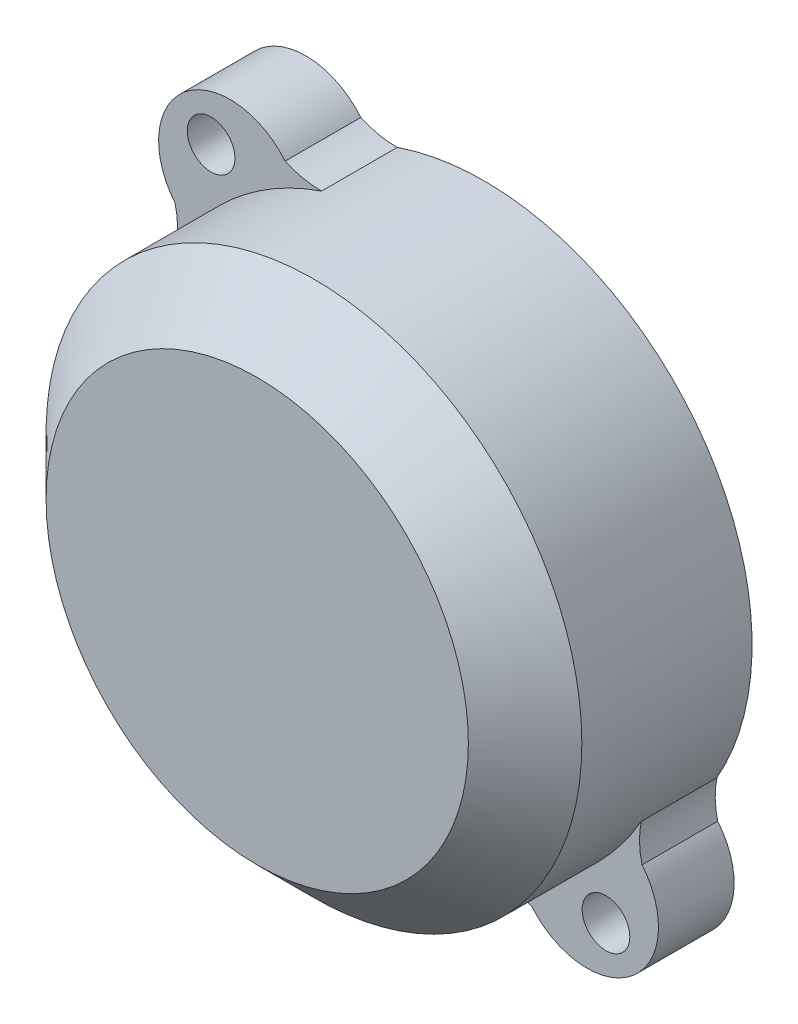
from build123d import *

# Parameters (mm, degrees)
SKETCH1_R           = 22.482
SKETCH1_R_2         = 19.45
SKETCH1_R_3         = 5
SKETCH1_R_4         = 2.8
BOSS_EXTRUDE1_DEPTH = 19.05
SKETCH1_5_R         = 2
BOSS_EXTRUDE3_DEPTH = 6.35
CHAMFER1_SIZE       = 4.7625
SHELL1_START        = -959.849406281
SHELL1_OUTLINE_R    = 20.481999936
SHELL1_DEPTH        = 13.459072749
SHELL1_2_DEPTH      = 4.349999936


with BuildPart() as part:
    # Sketch1 → Boss-Extrude1 (new body)
    # profile 1 of 6: a face of its own
    with BuildSketch(Plane.XY.offset(-959.849406281)):
        with Locations(Location((-167.581326331, 1325.789589838, 0), (0, 0, 180))):
            Circle(SKETCH1_R)
        with Locations((-167.581326331, 1325.789589838)):
            Circle(SKETCH1_R_2, mode=Mode.SUBTRACT)
    # profile 2 of 6: a face of its own
    with BuildSketch(Plane.XY.offset(-959.849406281)):
        with Locations((-167.581326331, 1325.789589838)):
            Circle(SKETCH1_R_2)
        with Locations((-158.719406684, 1324.967166478)):
            Circle(SKETCH1_R_3, mode=Mode.SUBTRACT)
        with Locations((-176.443245977, 1326.612013197)):
            Circle(SKETCH1_R_3, mode=Mode.SUBTRACT)
        with Locations((-168.704072827, 1313.691575939)):
            Circle(SKETCH1_R_4, mode=Mode.SUBTRACT)
        Polygon((-169.416951474, 1318.076211503), (-167.966159705, 1333.709036048), (-165.745701187, 1333.502968172), (-167.196492956, 1317.870143628), align=None, mode=Mode.SUBTRACT)
    # profile 3 of 6: a face of its own
    with BuildSketch(Plane.XY.offset(-959.849406281)):
        with Locations((-168.704072827, 1313.691575939)):
            Circle(SKETCH1_R_4)
    # profile 4 of 6: a face of its own
    with BuildSketch(Plane.XY.offset(-959.849406281)):
        with Locations((-158.719406684, 1324.967166478)):
            Circle(SKETCH1_R_3)
    # profile 5 of 6: a face of its own
    with BuildSketch(Plane.XY.offset(-959.849406281)):
        Polygon((-167.966159705, 1333.709036048), (-165.745701187, 1333.502968172), (-167.196492956, 1317.870143628), (-169.416951474, 1318.076211503), align=None)
    # profile 6 of 6: a face of its own
    with BuildSketch(Plane.XY.offset(-959.849406281)):
        with Locations((-176.443245977, 1326.612013197)):
            Circle(SKETCH1_R_3)
    extrude(amount=BOSS_EXTRUDE1_DEPTH)

    # Sketch1<5> → Boss-Extrude3 (add)
    # profile 1 of 2: a face of its own
    with BuildSketch(Plane.XY.offset(-959.849406281)):
        with BuildLine():
            ThreePointArc((-187.111667422, 1336.925392497), (-181.91942666, 1343.106032976), (-174.878765823, 1347.054295358))
            ThreePointArc((-174.878765823, 1347.054295358), (-176.443944893, 1347.205674138), (-177.935770468, 1347.702823524))
            ThreePointArc((-177.935770468, 1347.702823524), (-186.383740435, 1348.497684162), (-187.178601073, 1340.049714195))
            ThreePointArc((-187.178601073, 1340.049714195), (-186.968441908, 1338.4913387), (-187.111667422, 1336.925392497))
        make_face()
        with Locations((-184.151583548, 1345.801858569)):
            Circle(SKETCH1_5_R, mode=Mode.SUBTRACT)
    # profile 2 of 2: a face of its own
    with BuildSketch(Plane.XY.offset(-959.849406281)):
        with BuildLine():
            ThreePointArc((-147.984051588, 1311.529465481), (-148.194210754, 1313.087840976), (-148.050985239, 1314.653787179))
            ThreePointArc((-148.050985239, 1314.653787179), (-153.243226001, 1308.4731467), (-160.283886838, 1304.524884318))
            ThreePointArc((-160.283886838, 1304.524884318), (-158.718707768, 1304.373505537), (-157.226882193, 1303.876356151))
            ThreePointArc((-157.226882193, 1303.876356151), (-148.778912226, 1303.081495514), (-147.984051588, 1311.529465481))
        make_face()
        with Locations((-151.011069114, 1305.777321107)):
            Circle(SKETCH1_5_R, mode=Mode.SUBTRACT)
    extrude(amount=BOSS_EXTRUDE3_DEPTH)

    # Chamfer1
    chamfer1_edges = [part.edges().sort_by_distance(p)[0] for p in [
        (-145.099326331, 1325.789589838, -940.799406281),
    ]]
    chamfer(chamfer1_edges, length=CHAMFER1_SIZE)

    # Shell1: read off the stored shape, not the designer's step
    # Shell1 outline → Shell1 (cut)
    with BuildSketch(Plane.XY.offset(SHELL1_START)):
        with Locations((-167.581326331, 1325.789589838)):
            Circle(SHELL1_OUTLINE_R)
    extrude(amount=SHELL1_DEPTH, mode=Mode.SUBTRACT)

    # Shell1 2 outline → Shell1 2 (cut)
    with BuildSketch(Plane.XY.offset(SHELL1_START)):
        with BuildLine():
            ThreePointArc((-179.248478566, 1346.124035779), (-179.779181822, 1346.754235772), (-180.427741548, 1347.262338379))
            ThreePointArc((-180.427741548, 1347.262338379), (-181.600547064, 1342.720914984), (-186.281027509, 1342.415788733))
            ThreePointArc((-186.281027509, 1342.415788733), (-185.902815813, 1341.683836624), (-185.382666181, 1341.044898178))
            ThreePointArc((-185.382666181, 1341.044898178), (-184.97132452, 1338.625607411), (-185.229107011, 1336.185173441))
            ThreePointArc((-185.229107011, 1336.185173441), (-180.643908398, 1341.565561159), (-174.502685337, 1345.066703493))
            ThreePointArc((-174.502685337, 1345.066703493), (-176.948372758, 1345.268651042), (-179.248478566, 1346.124035779))
        make_face()
        with BuildLine():
            ThreePointArc((-149.77998648, 1310.534281498), (-150.191328141, 1312.953572265), (-149.93354565, 1315.394006235))
            ThreePointArc((-149.93354565, 1315.394006235), (-154.518744264, 1310.013618517), (-160.659967324, 1306.512476183))
            ThreePointArc((-160.659967324, 1306.512476183), (-158.214279903, 1306.310528634), (-155.914174095, 1305.455143896))
            ThreePointArc((-155.914174095, 1305.455143896), (-155.383470839, 1304.824943903), (-154.734911113, 1304.316841296))
            ThreePointArc((-154.734911113, 1304.316841296), (-153.562105598, 1308.858264691), (-148.881625153, 1309.163390942))
            ThreePointArc((-148.881625153, 1309.163390942), (-149.259836848, 1309.895343052), (-149.77998648, 1310.534281498))
        make_face()
    extrude(amount=SHELL1_2_DEPTH, mode=Mode.SUBTRACT)

    # Shell1 3 outline → Shell1 3 (revolve, cut)
    with BuildSketch(Plane(origin=(-167.581326331, 1325.789589838, 0), x_dir=(1, 0, 0), z_dir=(0, -1, 0))):
        Polygon((16.891072849, -942.799406345), (0, -942.799406345), (0, -946.390333532), (20.481999936, -946.390333532), align=None)
    revolve(axis=Axis((-167.581326331, 1325.789589838, 0), (0, 0, 1)), mode=Mode.SUBTRACT)


solid = part.part
